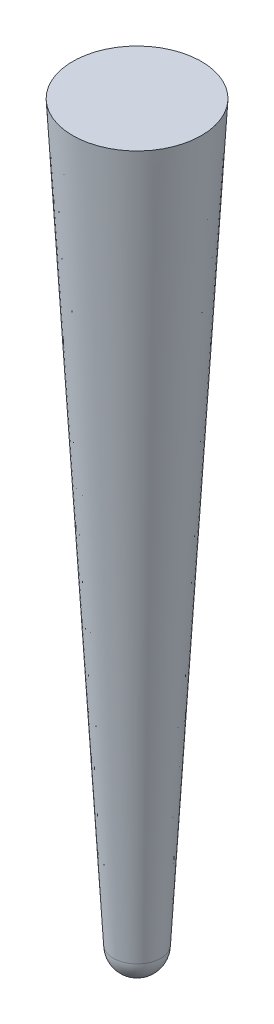
from build123d import *


with BuildPart() as part:
    # Sketch1 → Revolve1 (revolve)
    with BuildSketch(Plane.XY):
        with BuildLine():
            Line((21.59, 29.732800752), (0, 29.732800752))
            Line((0, 29.732800752), (0, -224.267199248))
            ThreePointArc((0, -224.267199248), (5.612660076, -221.942359324), (7.9375, -216.329699248))
            Line((7.9375, -216.329699248), (21.59, 29.732800752))
        make_face()
    revolve(axis=Axis((0, -224.267199248, 0), (0, 1, 0)))


solid = part.part
